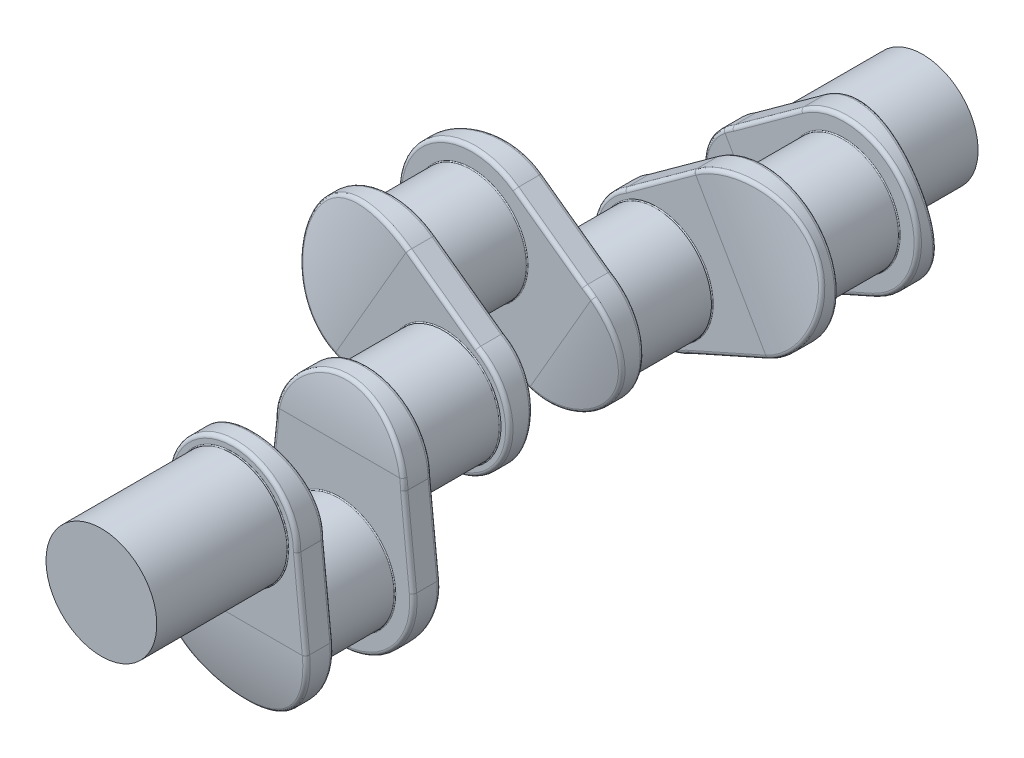
from build123d import *

# Parameters (mm, degrees)
SKETCH1_R               = 38.1
BOSS_EXTRUDE1_DEPTH     = 27.31
BOSS_EXTRUDE2_DEPTH     = 19
SKETCH3_R               = 38.1
BOSS_EXTRUDE3_DEPTH     = 26.67
CUT_EXTRUDE1_DEPTH      = 140.856794258
CUT_EXTRUDE1_DEPTH_BACK = 140.856794258
CUT_EXTRUDE2_DEPTH      = 140.856794295
CUT_EXTRUDE2_DEPTH_BACK = 140.856794295
FILLET1_R               = 2.54
FILLET2_R               = 0.64
LPATTERN1_COUNT         = 3
LPATTERN1_PITCH         = 145.96
BODY_MOVE_COPY1_ANGLE   = 120
BODY_MOVE_COPY2_ANGLE   = 120
SKETCH6_R               = 38.1
BOSS_EXTRUDE4_DEPTH     = 63.5
BOSS_EXTRUDE5_START     = 63.5
SKETCH7_R               = 38.1
BOSS_EXTRUDE5_DEPTH     = 63.5


with BuildPart() as part:
    # Sketch1 → Boss-Extrude1 (new body)
    with BuildSketch(Plane.XY):
        Circle(SKETCH1_R)
    extrude(amount=BOSS_EXTRUDE1_DEPTH)

    # Sketch2 → Boss-Extrude2 (add)
    with BuildSketch(Plane.XY.offset(27.31)):
        with BuildLine():
            Line((-44.45, 63.5), (-50.525695197, 5.272013362))
            ThreePointArc((-50.525695197, 5.272013362), (0, -50.8), (50.525695197, 5.272013362))
            Line((50.525695197, 5.272013362), (44.45, 63.5))
            ThreePointArc((44.45, 63.5), (0, 107.95), (-44.45, 63.5))
        make_face()
    extrude(amount=BOSS_EXTRUDE2_DEPTH)

    # Sketch3 → Boss-Extrude3 (add)
    with BuildSketch(Plane.XY.offset(46.31)):
        with Locations((0, 63.5)):
            Circle(SKETCH3_R)
    extrude(amount=BOSS_EXTRUDE3_DEPTH)

    # Sketch4 → Cut-Extrude1 (cut, two sides: drawn at the far end of the back side and taken through both)
    with BuildSketch(Plane(origin=(0, 0, 0), x_dir=(0, 0, -1), z_dir=(1, 0, 0)).offset(-CUT_EXTRUDE1_DEPTH_BACK)):
        with BuildLine():
            Line((-46.31, 5.272013362), (-55.669861806, 5.272013362))
            Line((-55.669861806, 5.272013362), (-55.669861806, -50.8))
            Line((-55.669861806, -50.8), (-36.81, -50.8))
            ThreePointArc((-36.81, -50.8), (-43.935570603, -23.166474332), (-46.31, 5.272013362))
        make_face()
    extrude(amount=CUT_EXTRUDE1_DEPTH + CUT_EXTRUDE1_DEPTH_BACK, mode=Mode.SUBTRACT)

    # Sketch5 → Cut-Extrude2 (cut, two sides: drawn at the far end of the back side and taken through both)
    with BuildSketch(Plane(origin=(0, 0, 0), x_dir=(0, 0, -1), z_dir=(1, 0, 0)).offset(-CUT_EXTRUDE2_DEPTH_BACK)):
        with BuildLine():
            Line((-32.31, 107.95), (-21.804607757, 107.95))
            Line((-21.804607757, 107.95), (-21.804607757, 63.5))
            Line((-21.804607757, 63.5), (-27.31, 63.5))
            ThreePointArc((-27.31, 63.5), (-28.332895265, 85.891153513), (-32.31, 107.95))
        make_face()
    extrude(amount=CUT_EXTRUDE2_DEPTH + CUT_EXTRUDE2_DEPTH_BACK, mode=Mode.SUBTRACT)

    # Fillet1
    fillet1_edges = [part.edges().sort_by_distance(p)[0] for p in [
        (-47.487847598, 34.386006681, 27.31),
        (0, -50.8, 27.31),
        (-47.487847598, 34.386006681, 46.31),
        (-50.546959134, 5.064081584, 46.31),
        (37.588258055, -34.17254537, 41.692275626),
        (50.546959134, 5.064081584, 46.31),
        (0, 107.95, 32.31),
        (47.487847598, 34.386006681, 27.31),
        (0, 107.95, 46.31),
        (47.487847598, 34.386006681, 46.31),
    ]]
    fillet(fillet1_edges, radius=FILLET1_R)

    # Fillet2
    fillet2_edges = [part.edges().sort_by_distance(p)[0] for p in [
        (-38.1, 0, 27.31),
        (-38.1, 63.5, 46.31),
    ]]
    fillet(fillet2_edges, radius=FILLET2_R)

    # Mirror1: part across plane


with BuildPart() as part_1:
    add(part.part)
    add(part.part.mirror(Plane.XY))


with BuildPart() as lpattern1_1:
    # LPattern1: pattern copy
    add(part_1.part.moved(Location(Vector(0, 0, -1) * (1 * LPATTERN1_PITCH))))


with BuildPart() as lpattern1_2:
    # LPattern1: pattern copy
    add(part_1.part.moved(Location(Vector(0, 0, -1) * (2 * LPATTERN1_PITCH))))


with BuildPart() as lpattern1_1_1:
    # Body-Move/Copy1: moved
    add(lpattern1_1.part.rotate(Axis((0, 63.5, 0), (0, 0, -1)), BODY_MOVE_COPY1_ANGLE))


with BuildPart() as lpattern1_2_1:
    # Body-Move/Copy2: moved
    add(lpattern1_2.part.rotate(Axis((0, 63.5, 0), (0, 0, 1)), BODY_MOVE_COPY2_ANGLE))

    # Sketch7 → Boss-Extrude5 (add)
    with BuildSketch(Plane(origin=(0, 0, -364.9), x_dir=(-1, 0, 0), z_dir=(0, 0, -1)).offset(BOSS_EXTRUDE5_START)):
        with Locations((0, 63.5)):
            Circle(SKETCH7_R)
    extrude(amount=-BOSS_EXTRUDE5_DEPTH)


with BuildPart() as part_2:
    add(part_1.part)

    # Sketch6 → Boss-Extrude4 (add)
    with BuildSketch(Plane.XY.offset(72.98)):
        with Locations((0, 63.5)):
            Circle(SKETCH6_R)
    extrude(amount=BOSS_EXTRUDE4_DEPTH)

    # Combine1: union LPattern1_1, LPattern1_2
    add(lpattern1_1_1.part)
    add(lpattern1_2_1.part)


solid = part_2.part
